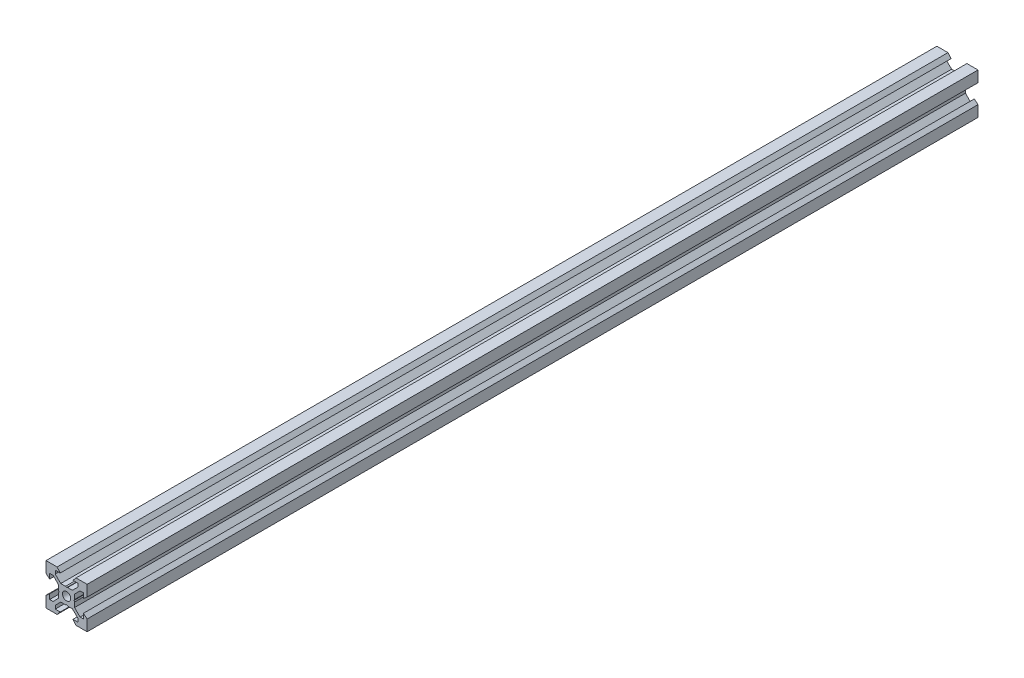
from build123d import *

# Parameters (mm, degrees)
SKETCH1_R           = 2
BOSS_EXTRUDE1_DEPTH = 216.605


with BuildPart() as part:
    # Sketch1 → Boss-Extrude1 (new, symmetric)
    with BuildSketch(Plane.XY):
        Polygon((10, 4.610379336), (10, 10), (4.610379336, 10), (3.1, 8.2), (5.5, 8.2), (5.5, 6.560660172), (2.839339828, 3.9), (0.519615242, 3.9), (0, 3.6), (-0.519615242, 3.9), (-2.839339828, 3.9), (-5.5, 6.560660172), (-5.5, 8.2), (-3.1, 8.2), (-4.610379336, 10), (-10, 10), (-10, 4.610379336), (-8.2, 3.1), (-8.2, 5.5), (-6.560660172, 5.5), (-3.9, 2.839339828), (-3.9, 0.519615242), (-3.6, 0), (-3.9, -0.519615242), (-3.9, -2.839339828), (-6.560660172, -5.5), (-8.2, -5.5), (-8.2, -3.1), (-10, -4.610379336), (-10, -10), (-4.610379336, -10), (-3.1, -8.2), (-5.5, -8.2), (-5.5, -6.560660172), (-2.839339828, -3.9), (-0.519615242, -3.9), (0, -3.6), (0.519615242, -3.9), (2.839339828, -3.9), (5.5, -6.560660172), (5.5, -8.2), (3.1, -8.2), (4.610379336, -10), (10, -10), (10, -4.610379336), (8.2, -3.1), (8.2, -5.5), (6.560660172, -5.5), (3.9, -2.839339828), (3.9, -0.519615242), (3.6, 0), (3.9, 0.519615242), (3.9, 2.839339828), (6.560660172, 5.5), (8.2, 5.5), (8.2, 3.1), align=None)
        Circle(SKETCH1_R, mode=Mode.SUBTRACT)
    extrude(amount=BOSS_EXTRUDE1_DEPTH, both=True)


solid = part.part
